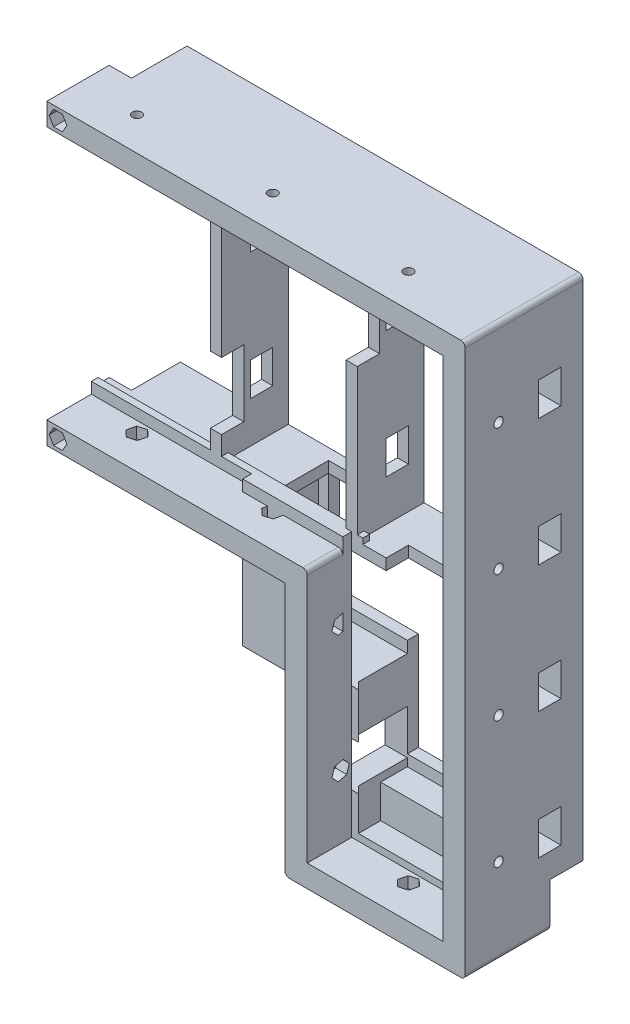
from build123d import *

# Parameters (mm, degrees)
SALIENTE_EXTRUIR1_DEPTH        = 23
CORTAR_EXTRUIR1_DEPTH          = 20
CORTAR_EXTRUIR17_DEPTH         = 231.271578793
SALIENTE_EXTRUIR5_DEPTH        = 30
CORTAR_EXTRUIR18_DEPTH         = 3
SALIENTE_EXTRUIR6_REACH        = 309.885
CROQUIS26_W                    = 5
CROQUIS26_H                    = 30
CROQUIS27_W                    = 30
CROQUIS27_H                    = 5
SALIENTE_EXTRUIR7_DEPTH        = 366
CROQUIS4_W                     = 10
CROQUIS4_H                     = 15
CORTAR_EXTRUIR3_DEPTH          = 407.536591219
CROQUIS6_R                     = 2.1
CORTAR_EXTRUIR5_DEPTH          = 316.678634057
CORTAR_EXTRUIR6_DEPTH          = 5
CORTAR_EXTRUIR7_DEPTH          = 5
CORTAR_EXTRUIR8_DEPTH          = 5
CROQUIS11_R                    = 2.1
CORTAR_EXTRUIR9_DEPTH          = 407.536591219
CORTAR_EXTRUIR10_DEPTH         = 5
CORTAR_EXTRUIR11_DEPTH         = 5
CORTAR_EXTRUIR12_DEPTH         = 5
CORTAR_EXTRUIR13_DEPTH         = 5
CROQUIS28_W                    = 15
CROQUIS28_H                    = 20
CORTAR_EXTRUIR19_DEPTH         = 407.536591219
SALIENTE_EXTRUIR8_DEPTH        = 72
CORTAR_EXTRUIR20_REACH         = 344.173
CROQUIS31_W                    = 10
CROQUIS31_H                    = 30
MATRIZL1_COUNT                 = 3
MATRIZL1_PITCH                 = 122
CORTAR_EXTRUIR28_REACH         = 288.476
CROQUIS40_W                    = 10
CROQUIS40_H                    = 30
MATRIZL2_COUNT                 = 2
MATRIZL2_PITCH                 = 122
CROQUIS32_W                    = 30
CROQUIS32_H                    = 10
CORTAR_EXTRUIR21_DEPTH         = 10
CROQUIS41_W                    = 71
CROQUIS41_H                    = 5
SALIENTE_EXTRUIR9_DEPTH        = 5
CORTAR_EXTRUIR22_REACH         = 332.607
CROQUIS34_W                    = 25
CROQUIS34_H                    = 20
CROQUIS37_R                    = 2.1
CORTAR_EXTRUIR25_DEPTH         = 236.44426092
CROQUIS38_R                    = 3.45
CORTAR_EXTRUIR26_DEPTH         = 10
CORTAR_EXTRUIR27_DEPTH         = 10
CROQUIS42_W                    = 45
CROQUIS42_H                    = 65
SALIENTE_EXTRUIR10_DEPTH       = 4
SALIENTE_EXTRUIR11_DEPTH       = 33
CORTAR_EXTRUIR29_DEPTH         = 235.787137637
CORTAR_EXTRUIR29_DEPTH_BACK    = 30
CROQUIS44_W                    = 45
CROQUIS44_H                    = 52.5
CORTAR_EXTRUIR30_REACH         = 300.624
CROQUIS45_W                    = 10
CROQUIS45_H                    = 15
SALIENTE_EXTRUIR13_DEPTH       = 5
CORTAR_EXTRUIR31_REACH         = 234.704
CROQUIS47_W                    = 28.571161612
CROQUIS47_H                    = 21.740174065
CORTAR_EXTRUIR24_START         = -30
CORTAR_EXTRUIR24_OUTLINE_W     = 56
CORTAR_EXTRUIR24_OUTLINE_H     = 104
CORTAR_EXTRUIR24_DEPTH         = 53
CORTAR_EXTRUIR24_2_OUTLINE_W   = 10
CORTAR_EXTRUIR24_2_OUTLINE_H   = 12.5
CORTAR_EXTRUIR24_2_OUTLINE_R   = 2.1
CORTAR_EXTRUIR24_2_OUTLINE_H_2 = 10
CORTAR_EXTRUIR24_2_DEPTH       = 25
REDONDEO1_R                    = 2
CHAFL_N1_SIZE                  = 5


# Read off the part's stored shape, not the designer's step: Cortar-Extruir24
with BuildPart() as part:
    # Croquis1 → Saliente-Extruir1 (new body)
    with BuildSketch(Plane.XY):
        Polygon((-193, -124), (-193, 124), (193, 124), (193, -124), (112, -124), (112, -10), (-112, -10), (-112, -124), align=None)
    extrude(amount=SALIENTE_EXTRUIR1_DEPTH)

    # Croquis2 → Cortar-Extruir1 (cut)
    with BuildSketch(Plane.XY.offset(23)):
        Polygon((-183, 114), (183, 114), (183, -114), (122, -114), (122, 0), (-122, 0), (-122, -114), (-183, -114), align=None)
    extrude(amount=-CORTAR_EXTRUIR1_DEPTH, mode=Mode.SUBTRACT)

    # Croquis23 → Cortar-Extruir17 (cut, through all)
    with BuildSketch(Plane.XY.offset(3)):
        Polygon((-178, 109), (-178, -109), (-127, -109), (-127, 5), (127, 5), (127, -109), (178, -109), (178, 109), align=None)
    extrude(amount=-CORTAR_EXTRUIR17_DEPTH, mode=Mode.SUBTRACT)

    # Croquis24 → Saliente-Extruir5 (add)
    with BuildSketch(Plane(origin=(0, 0, 0), x_dir=(-1, 0, 0), z_dir=(0, 0, -1))):
        Polygon((-112, -124), (-193, -124), (-193, 124), (193, 124), (193, -124), (112, -124), (112, -10), (-112, -10), align=None)
        Polygon((-122, -114), (-183, -114), (-183, 114), (183, 114), (183, -114), (122, -114), (122, 0), (-122, 0), align=None, mode=Mode.SUBTRACT)
    extrude(amount=SALIENTE_EXTRUIR5_DEPTH)

    # Croquis25 → Cortar-Extruir18 (cut)
    with BuildSketch(Plane(origin=(0, 0, -30), x_dir=(-1, 0, 0), z_dir=(0, 0, -1))):
        Polygon((188, -119), (188, 119), (-188, 119), (-188, -119), (-117, -119), (-117, -5), (117, -5), (117, -119), align=None)
    extrude(amount=-CORTAR_EXTRUIR18_DEPTH, mode=Mode.SUBTRACT)

    # Saliente-Extruir6: up to this face of the body (flat: up to its plane)
    saliente_extruir6_end = Plane(part.part.faces().sort_by_distance((0, 0, -13.5))[0])
    # Croquis26 → Saliente-Extruir6 (add, up to the picked face)
    with BuildSketch(Plane.XZ.offset(-114), mode=Mode.PRIVATE) as saliente_extruir6_sk1:
        with Locations((-122, -12)):
            Rectangle(CROQUIS26_W, CROQUIS26_H)
    saliente_extruir6_tool1 = split(extrude(saliente_extruir6_sk1.sketch, amount=SALIENTE_EXTRUIR6_REACH, mode=Mode.PRIVATE), bisect_by=saliente_extruir6_end, keep=Keep.BOTH, mode=Mode.PRIVATE)
    # Croquis26 → Saliente-Extruir6 (add, up to the picked face)
    with BuildSketch(Plane.XZ.offset(-114), mode=Mode.PRIVATE) as saliente_extruir6_sk2:
        with Locations((122, -12)):
            Rectangle(CROQUIS26_W, CROQUIS26_H)
    saliente_extruir6_tool2 = split(extrude(saliente_extruir6_sk2.sketch, amount=SALIENTE_EXTRUIR6_REACH, mode=Mode.PRIVATE), bisect_by=saliente_extruir6_end, keep=Keep.BOTH, mode=Mode.PRIVATE)
    # Croquis26 → Saliente-Extruir6 (add, up to the picked face)
    with BuildSketch(Plane.XZ.offset(-114), mode=Mode.PRIVATE) as saliente_extruir6_sk3:
        with Locations((0, -12)):
            Rectangle(CROQUIS26_W, CROQUIS26_H)
    saliente_extruir6_tool3 = split(extrude(saliente_extruir6_sk3.sketch, amount=SALIENTE_EXTRUIR6_REACH, mode=Mode.PRIVATE), bisect_by=saliente_extruir6_end, keep=Keep.BOTH, mode=Mode.PRIVATE)
    # Croquis26 → Saliente-Extruir6 (add, up to the picked face)
    with BuildSketch(Plane.XZ.offset(-114), mode=Mode.PRIVATE) as saliente_extruir6_sk4:
        with Locations((-61, -12)):
            Rectangle(CROQUIS26_W, CROQUIS26_H)
    saliente_extruir6_tool4 = split(extrude(saliente_extruir6_sk4.sketch, amount=SALIENTE_EXTRUIR6_REACH, mode=Mode.PRIVATE), bisect_by=saliente_extruir6_end, keep=Keep.BOTH, mode=Mode.PRIVATE)
    # Croquis26 → Saliente-Extruir6 (add, up to the picked face)
    with BuildSketch(Plane.XZ.offset(-114), mode=Mode.PRIVATE) as saliente_extruir6_sk5:
        with Locations((61, -12)):
            Rectangle(CROQUIS26_W, CROQUIS26_H)
    saliente_extruir6_tool5 = split(extrude(saliente_extruir6_sk5.sketch, amount=SALIENTE_EXTRUIR6_REACH, mode=Mode.PRIVATE), bisect_by=saliente_extruir6_end, keep=Keep.BOTH, mode=Mode.PRIVATE)
    add(saliente_extruir6_tool1.solids().sort_by(Axis((-122, 114, -12), (0, -1, 0)))[0])
    add(saliente_extruir6_tool2.solids().sort_by(Axis((122, 114, -12), (0, -1, 0)))[0])
    add(saliente_extruir6_tool3.solids().sort_by(Axis((0, 114, -12), (0, -1, 0)))[0])
    add(saliente_extruir6_tool4.solids().sort_by(Axis((-61, 114, -12), (0, -1, 0)))[0])
    add(saliente_extruir6_tool5.solids().sort_by(Axis((61, 114, -12), (0, -1, 0)))[0])

    # Croquis27 → Saliente-Extruir7 (add)
    with BuildSketch(Plane(origin=(-183, 0, 0), x_dir=(0, 0, -1), z_dir=(1, 0, 0))):
        with Locations((12, 0)):
            Rectangle(CROQUIS27_W, CROQUIS27_H)
    saliente_extruir7 = extrude(amount=SALIENTE_EXTRUIR7_DEPTH)

    # Simetría6: Saliente-Extruir7 across plane
    add(saliente_extruir7.mirror(Plane(origin=(0, 0, 0), x_dir=(0, 0, 1), z_dir=(1, 0, 0))))

    # Croquis4 → Cortar-Extruir3 (cut, through all)
    with BuildSketch(Plane(origin=(193, 0, 0), x_dir=(0, 0, -1), z_dir=(1, 0, 0))):
        with Locations((15, 85.5)):
            Rectangle(CROQUIS4_W, CROQUIS4_H)
        with Locations((15, 28.5)):
            Rectangle(CROQUIS4_W, CROQUIS4_H)
        with Locations((15, -28.5)):
            Rectangle(CROQUIS4_W, CROQUIS4_H)
        with Locations((15, -85.5)):
            Rectangle(CROQUIS4_W, CROQUIS4_H)
    extrude(amount=-CORTAR_EXTRUIR3_DEPTH, mode=Mode.SUBTRACT)

    # Croquis6 → Cortar-Extruir5 (cut, through all)
    with BuildSketch(Plane(origin=(0, 124, 0), x_dir=(1, 0, 0), z_dir=(0, 1, 0))):
        with Locations(Location((30.5, -8, 0), (0, 0, 270))):
            Circle(CROQUIS6_R)
        with Locations(Location((91.5, -8, 0), (0, 0, 270))):
            Circle(CROQUIS6_R)
        with Locations(Location((152.5, -8, 0), (0, 0, 270))):
            Circle(CROQUIS6_R)
    cortar_extruir5 = extrude(amount=-CORTAR_EXTRUIR5_DEPTH, mode=Mode.SUBTRACT)

    # Croquis7 → Cortar-Extruir6 (cut)
    with BuildSketch(Plane.XZ.offset(-114)):
        Polygon((31.42633523, 4.125480282), (34.318600118, 6.864969983), (33.392264888, 10.7394897), (29.57366477, 11.874519718), (26.681399882, 9.135030017), (27.607735112, 5.2605103), align=None)
        Polygon((92.42633523, 4.125480282), (95.318600118, 6.864969983), (94.392264888, 10.7394897), (90.57366477, 11.874519718), (87.681399882, 9.135030017), (88.607735112, 5.2605103), align=None)
        Polygon((153.42633523, 4.125480282), (156.318600118, 6.864969983), (155.392264888, 10.7394897), (151.57366477, 11.874519718), (148.681399882, 9.135030017), (149.607735112, 5.2605103), align=None)
    cortar_extruir6 = extrude(amount=-CORTAR_EXTRUIR6_DEPTH, mode=Mode.SUBTRACT)

    # Croquis9 → Cortar-Extruir7 (cut)
    with BuildSketch(Plane(origin=(0, 0, 0), x_dir=(1, 0, 0), z_dir=(0, 1, 0))):
        Polygon((31.42633523, -4.125480282), (27.607735112, -5.2605103), (26.681399882, -9.135030017), (29.57366477, -11.874519718), (33.392264888, -10.7394897), (34.318600118, -6.864969983), align=None)
        Polygon((92.42633523, -4.125480282), (88.607735112, -5.2605103), (87.681399882, -9.135030017), (90.57366477, -11.874519718), (94.392264888, -10.7394897), (95.318600118, -6.864969983), align=None)
    cortar_extruir7 = extrude(amount=-CORTAR_EXTRUIR7_DEPTH, mode=Mode.SUBTRACT)

    # Croquis10 → Cortar-Extruir8 (cut)
    with BuildSketch(Plane(origin=(0, -114, 0), x_dir=(1, 0, 0), z_dir=(0, 1, 0))):
        Polygon((153.42633523, -4.125480282), (149.607735112, -5.2605103), (148.681399882, -9.135030017), (151.57366477, -11.874519718), (155.392264888, -10.7394897), (156.318600118, -6.864969983), align=None)
    cortar_extruir8 = extrude(amount=-CORTAR_EXTRUIR8_DEPTH, mode=Mode.SUBTRACT)

    # Simetría5: Cortar-Extruir5, Cortar-Extruir6, Cortar-Extruir7, Cortar-Extruir8 across plane
    add(cortar_extruir5.mirror(Plane(origin=(0, 0, 0), x_dir=(0, 0, 1), z_dir=(1, 0, 0))), mode=Mode.SUBTRACT)
    add(cortar_extruir6.mirror(Plane(origin=(0, 0, 0), x_dir=(0, 0, 1), z_dir=(1, 0, 0))), mode=Mode.SUBTRACT)
    add(cortar_extruir7.mirror(Plane(origin=(0, 0, 0), x_dir=(0, 0, 1), z_dir=(1, 0, 0))), mode=Mode.SUBTRACT)
    add(cortar_extruir8.mirror(Plane(origin=(0, 0, 0), x_dir=(0, 0, 1), z_dir=(1, 0, 0))), mode=Mode.SUBTRACT)

    # Croquis11 → Cortar-Extruir9 (cut, through all)
    with BuildSketch(Plane.ZY.offset(193)):
        with Locations((8, 85.5)):
            Circle(CROQUIS11_R)
        with Locations((8, 28.5)):
            Circle(CROQUIS11_R)
        with Locations((8, -28.5)):
            Circle(CROQUIS11_R)
        with Locations((8, -85.5)):
            Circle(CROQUIS11_R)
    extrude(amount=-CORTAR_EXTRUIR9_DEPTH, mode=Mode.SUBTRACT)

    # Croquis12 → Cortar-Extruir10 (cut)
    with BuildSketch(Plane(origin=(-183, 0, 0), x_dir=(0, 0, -1), z_dir=(1, 0, 0))):
        Polygon((-4.125480282, 84.57366477), (-5.2605103, 88.392264888), (-9.135030017, 89.318600118), (-11.874519718, 86.42633523), (-10.7394897, 82.607735112), (-6.864969983, 81.681399882), align=None)
        Polygon((-4.125480282, 27.57366477), (-5.2605103, 31.392264888), (-9.135030017, 32.318600118), (-11.874519718, 29.42633523), (-10.7394897, 25.607735112), (-6.864969983, 24.681399882), align=None)
        Polygon((-4.125480282, -29.42633523), (-5.2605103, -25.607735112), (-9.135030017, -24.681399882), (-11.874519718, -27.57366477), (-10.7394897, -31.392264888), (-6.864969983, -32.318600118), align=None)
        Polygon((-4.125480282, -86.42633523), (-5.2605103, -82.607735112), (-9.135030017, -81.681399882), (-11.874519718, -84.57366477), (-10.7394897, -88.392264888), (-6.864969983, -89.318600118), align=None)
    extrude(amount=-CORTAR_EXTRUIR10_DEPTH, mode=Mode.SUBTRACT)

    # Croquis13 → Cortar-Extruir11 (cut)
    with BuildSketch(Plane.ZY.offset(-183)):
        Polygon((8, 24.516283143), (11.45, 26.508141571), (11.45, 30.491858429), (8, 32.483716857), (4.55, 30.491858429), (4.55, 26.508141571), align=None)
        Polygon((8, 81.516283143), (11.45, 83.508141571), (11.45, 87.491858429), (8, 89.483716857), (4.55, 87.491858429), (4.55, 83.508141571), align=None)
        Polygon((8, -32.483716857), (11.45, -30.491858429), (11.45, -26.508141571), (8, -24.516283143), (4.55, -26.508141571), (4.55, -30.491858429), align=None)
        Polygon((8, -89.483716857), (11.45, -87.491858429), (11.45, -83.508141571), (8, -81.516283143), (4.55, -83.508141571), (4.55, -87.491858429), align=None)
    extrude(amount=-CORTAR_EXTRUIR11_DEPTH, mode=Mode.SUBTRACT)

    # Croquis14 → Cortar-Extruir12 (cut)
    with BuildSketch(Plane(origin=(122, 0, 0), x_dir=(0, 0, -1), z_dir=(1, 0, 0))):
        Polygon((-4.125480282, -84.57366477), (-6.864969983, -81.681399882), (-10.7394897, -82.607735112), (-11.874519718, -86.42633523), (-9.135030017, -89.318600118), (-5.2605103, -88.392264888), align=None)
        Polygon((-4.125480282, -27.57366477), (-6.864969983, -24.681399882), (-10.7394897, -25.607735112), (-11.874519718, -29.42633523), (-9.135030017, -32.318600118), (-5.2605103, -31.392264888), align=None)
    extrude(amount=-CORTAR_EXTRUIR12_DEPTH, mode=Mode.SUBTRACT)

    # Croquis15 → Cortar-Extruir13 (cut)
    with BuildSketch(Plane.ZY.offset(122)):
        Polygon((4.125480282, -84.57366477), (5.2605103, -88.392264888), (9.135030017, -89.318600118), (11.874519718, -86.42633523), (10.7394897, -82.607735112), (6.864969983, -81.681399882), align=None)
        Polygon((4.125480282, -27.57366477), (5.2605103, -31.392264888), (9.135030017, -32.318600118), (11.874519718, -29.42633523), (10.7394897, -25.607735112), (6.864969983, -24.681399882), align=None)
    extrude(amount=-CORTAR_EXTRUIR13_DEPTH, mode=Mode.SUBTRACT)

    # Croquis28 → Cortar-Extruir19 (cut, through all)
    with BuildSketch(Plane.ZY.offset(193)):
        with Locations((-22.5, -114)):
            Rectangle(CROQUIS28_W, CROQUIS28_H)
    extrude(amount=-CORTAR_EXTRUIR19_DEPTH, mode=Mode.SUBTRACT)

    # Croquis30 → Saliente-Extruir8 (add)
    with BuildSketch(Plane.ZY.offset(117)):
        Polygon((-30, -104), (-30, -99), (-10, -99), (-10, -124), (-15, -124), (-15, -104), align=None)
    saliente_extruir8 = extrude(amount=SALIENTE_EXTRUIR8_DEPTH)

    # Simetría7: Saliente-Extruir8 across plane
    add(saliente_extruir8.mirror(Plane(origin=(0, 0, 0), x_dir=(0, 0, 1), z_dir=(1, 0, 0))))

    # Croquis31 → Cortar-Extruir20 (cut, up to next)
    with BuildSketch(Plane.ZY.offset(124.5), mode=Mode.PRIVATE) as cortar_extruir20_sk1:
        with Locations((-2, 85.5)):
            Rectangle(CROQUIS31_W, CROQUIS31_H)
    cortar_extruir20_tool1 = extrude(cortar_extruir20_sk1.sketch, amount=-CORTAR_EXTRUIR20_REACH, mode=Mode.PRIVATE) & part.part
    cortar_extruir20 = cortar_extruir20_tool1.solids().sort_by_distance((-124.5, 85.5, -2))[0]
    add(cortar_extruir20, mode=Mode.SUBTRACT)

    # MatrizL1: Cortar-Extruir20 ×3
    with Locations(*[(i * MATRIZL1_PITCH, 0, 0) for i in range(1, MATRIZL1_COUNT)]):
        add(cortar_extruir20, mode=Mode.SUBTRACT)

    # Croquis40 → Cortar-Extruir28 (cut, up to next)
    with BuildSketch(Plane.ZY.offset(63.5), mode=Mode.PRIVATE) as cortar_extruir28_sk1:
        with Locations((-2, 28.5)):
            Rectangle(CROQUIS40_W, CROQUIS40_H)
    cortar_extruir28_tool1 = extrude(cortar_extruir28_sk1.sketch, amount=-CORTAR_EXTRUIR28_REACH, mode=Mode.PRIVATE) & part.part
    cortar_extruir28 = cortar_extruir28_tool1.solids().sort_by_distance((-63.5, 28.5, -2))[0]
    add(cortar_extruir28, mode=Mode.SUBTRACT)

    # MatrizL2: Cortar-Extruir28 ×2
    with Locations(*[(i * MATRIZL2_PITCH, 0, 0) for i in range(1, MATRIZL2_COUNT)]):
        add(cortar_extruir28, mode=Mode.SUBTRACT)

    # Croquis32 → Cortar-Extruir21 (cut)
    with BuildSketch(Plane.XZ.offset(2.5)):
        with Locations((-152.5, -2)):
            Rectangle(CROQUIS32_W, CROQUIS32_H)
        with Locations((152.5, -2)):
            Rectangle(CROQUIS32_W, CROQUIS32_H)
    extrude(amount=-CORTAR_EXTRUIR21_DEPTH, mode=Mode.SUBTRACT)

    # Croquis41 → Saliente-Extruir9 (add)
    with BuildSketch(Plane(origin=(0, 0, -27), x_dir=(-1, 0, 0), z_dir=(0, 0, -1))):
        with Locations((-152.5, -96.5)):
            Rectangle(CROQUIS41_W, CROQUIS41_H)
    extrude(amount=-SALIENTE_EXTRUIR9_DEPTH)

    # Croquis34 → Cortar-Extruir22 (cut, up to next)
    with BuildSketch(Plane(origin=(-112, 0, 0), x_dir=(0, 0, -1), z_dir=(1, 0, 0)), mode=Mode.PRIVATE) as cortar_extruir22_sk1:
        with Locations((9.5, -85.5)):
            Rectangle(CROQUIS34_W, CROQUIS34_H)
    cortar_extruir22_tool1 = extrude(cortar_extruir22_sk1.sketch, amount=-CORTAR_EXTRUIR22_REACH, mode=Mode.PRIVATE) & part.part
    cortar_extruir22 = cortar_extruir22_tool1.solids().sort_by_distance((-112, -85.5, -9.5))[0]
    add(cortar_extruir22, mode=Mode.SUBTRACT)

    # Simetría8: Cortar-Extruir22 across plane
    add(cortar_extruir22.mirror(Plane(origin=(0, 0, 0), x_dir=(0, 0, 1), z_dir=(1, 0, 0))), mode=Mode.SUBTRACT)

    # Croquis37 → Cortar-Extruir25 (cut, through all)
    with BuildSketch(Plane.XY.offset(23)):
        with Locations((10, -5)):
            Circle(CROQUIS37_R)
        with Locations((10, 119)):
            Circle(CROQUIS37_R)
    extrude(amount=-CORTAR_EXTRUIR25_DEPTH, mode=Mode.SUBTRACT)

    # Croquis38 → Cortar-Extruir26 (cut)
    with BuildSketch(Plane(origin=(0, 0, -30), x_dir=(-1, 0, 0), z_dir=(0, 0, -1))):
        with Locations((-10, -5)):
            Circle(CROQUIS38_R)
        with Locations((-10, 119)):
            Circle(CROQUIS38_R)
    extrude(amount=-CORTAR_EXTRUIR26_DEPTH, mode=Mode.SUBTRACT)

    # Croquis39 → Cortar-Extruir27 (cut)
    with BuildSketch(Plane.XY.offset(23)):
        Polygon((6.016283143, -5), (8.008141571, -8.45), (11.991858429, -8.45), (13.983716857, -5), (11.991858429, -1.55), (8.008141571, -1.55), align=None)
        Polygon((6.016283143, 119), (8.008141571, 115.55), (11.991858429, 115.55), (13.983716857, 119), (11.991858429, 122.45), (8.008141571, 122.45), align=None)
    extrude(amount=-CORTAR_EXTRUIR27_DEPTH, mode=Mode.SUBTRACT)

    # Croquis42 → Saliente-Extruir10 (add)
    with BuildSketch(Plane.XY.offset(3)):
        with Locations((99.5, -27.5)):
            Rectangle(CROQUIS42_W, CROQUIS42_H)
    extrude(amount=SALIENTE_EXTRUIR10_DEPTH)

    # Croquis43 → Saliente-Extruir11 (add)
    with BuildSketch(Plane(origin=(0, 0, 3), x_dir=(-1, 0, 0), z_dir=(0, 0, -1))):
        Polygon((-112, -60), (-112, -55), (-82, -55), (-82, -10), (-77, -10), (-77, -60), align=None)
    extrude(amount=SALIENTE_EXTRUIR11_DEPTH)

    # Croquis44 → Cortar-Extruir29 (cut, two sides: drawn at the far end of the back side and taken through both)
    with BuildSketch(Plane(origin=(0, 0, -27), x_dir=(-1, 0, 0), z_dir=(0, 0, -1)).offset(-CORTAR_EXTRUIR29_DEPTH_BACK)):
        with Locations((-104.5, -28.75)):
            Rectangle(CROQUIS44_W, CROQUIS44_H)
    extrude(amount=CORTAR_EXTRUIR29_DEPTH + CORTAR_EXTRUIR29_DEPTH_BACK, mode=Mode.SUBTRACT)

    # Croquis45 → Cortar-Extruir30 (cut, up to next)
    with BuildSketch(Plane.ZY.offset(-77), mode=Mode.PRIVATE) as cortar_extruir30_sk1:
        with Locations((-15, -28.5)):
            Rectangle(CROQUIS45_W, CROQUIS45_H)
    cortar_extruir30_tool1 = extrude(cortar_extruir30_sk1.sketch, amount=-CORTAR_EXTRUIR30_REACH, mode=Mode.PRIVATE) & part.part
    add(cortar_extruir30_tool1.solids().sort_by_distance((77, -28.5, -15))[0], mode=Mode.SUBTRACT)

    # Croquis46 → Saliente-Extruir13 (add)
    with BuildSketch(Plane(origin=(0, 0, -27), x_dir=(-1, 0, 0), z_dir=(0, 0, -1))):
        Polygon((-122, -55), (-122, -49.816161807), (-86.602121083, -49.816161807), (-86.602121083, -2.5), (-82, -2.5), (-82, -55), align=None)
    extrude(amount=-SALIENTE_EXTRUIR13_DEPTH)

    # Croquis47 → Cortar-Extruir31 (cut, up to next)
    with BuildSketch(Plane.XZ.offset(2.5), mode=Mode.PRIVATE) as cortar_extruir31_sk1:
        with Locations((100.887701889, -11.129912967)):
            Rectangle(CROQUIS47_W, CROQUIS47_H)
    cortar_extruir31_tool1 = extrude(cortar_extruir31_sk1.sketch, amount=-CORTAR_EXTRUIR31_REACH, mode=Mode.PRIVATE) & part.part
    add(cortar_extruir31_tool1.solids().sort_by_distance((100.887702, -2.5, -11.129913))[0], mode=Mode.SUBTRACT)

    # Cortar-Extruir24 outline → Cortar-Extruir24 (cut)
    with BuildSketch(Plane.XY.offset(CORTAR_EXTRUIR24_START)):
        Polygon((-112, -10), (5, -10), (5, 5), (2.5, 5), (2.5, 109), (5, 109), (5, 124), (-193, 124), (-193, -124), (-112, -124), align=None)
        Polygon((-127, -2.5), (-127, -75.5), (-122, -75.5), (-122, -95.5), (-127, -95.5), (-127, -99), (-178, -99), (-178, -2.5), align=None, mode=Mode.SUBTRACT)
        Polygon((-127, 2.5), (-178, 2.5), (-178, 109), (-124.5, 109), (-124.5, 5), (-127, 5), align=None, mode=Mode.SUBTRACT)
        with Locations((-91.5, 57)):
            Rectangle(CORTAR_EXTRUIR24_OUTLINE_W, CORTAR_EXTRUIR24_OUTLINE_H, mode=Mode.SUBTRACT)
        with Locations((-30.5, 57)):
            Rectangle(CORTAR_EXTRUIR24_OUTLINE_W, CORTAR_EXTRUIR24_OUTLINE_H, mode=Mode.SUBTRACT)
    extrude(amount=CORTAR_EXTRUIR24_DEPTH, mode=Mode.SUBTRACT)

    # Cortar-Extruir24 2 outline → Cortar-Extruir24 2 (cut)
    # profile 1 of 2: a face of its own
    with BuildSketch(Plane.XY.offset(CORTAR_EXTRUIR24_START)):
        with Locations((10, -3.75)):
            Rectangle(CORTAR_EXTRUIR24_2_OUTLINE_W, CORTAR_EXTRUIR24_2_OUTLINE_H)
        with Locations((10, -5)):
            Circle(CORTAR_EXTRUIR24_2_OUTLINE_R, mode=Mode.SUBTRACT)
    # profile 2 of 2: a face of its own
    with BuildSketch(Plane.XY.offset(CORTAR_EXTRUIR24_START)):
        with Locations((10, 119)):
            Rectangle(CORTAR_EXTRUIR24_2_OUTLINE_W, CORTAR_EXTRUIR24_2_OUTLINE_H_2)
        with Locations((10, 119)):
            Circle(CORTAR_EXTRUIR24_2_OUTLINE_R, mode=Mode.SUBTRACT)
    extrude(amount=CORTAR_EXTRUIR24_2_DEPTH, mode=Mode.SUBTRACT)

    # Redondeo1
    redondeo1_edges = [part.edges().sort_by_distance(p)[0] for p in [
        (193, -124, 4),
        (112, -124, 4),
        (193, 124, -3.5),
        (122, 0, 15),
    ]]
    fillet(redondeo1_edges, radius=REDONDEO1_R)

    # Chaflán1
    # the kernel refuses this chamfer: 5 mm, written as the material it takes off along each edge
    with BuildSketch(Plane(origin=(111.64158506, 109, 0), x_dir=(0, 0.9996219169112968, -0.027495876610586334), z_dir=(1, 0, 0))) as chafl_n1_piece_1_section:
        Polygon((CHAFL_N1_SIZE * 0.999621916911, CHAFL_N1_SIZE * 0.0274958766106), (-CHAFL_N1_SIZE * 0.0274958766106, CHAFL_N1_SIZE * 0.999621916911), (0, 0), align=None)
    chafl_n1_piece_1 = extrude(amount=66.35841494, mode=Mode.PRIVATE)
    chafl_n1_piece_1 = split(chafl_n1_piece_1, bisect_by=Plane(origin=(119.5, 110.643171669, 1.652020772), z_dir=(-1, 0, 0)), keep=Keep.TOP, mode=Mode.PRIVATE)
    chafl_n1_piece_1 = split(chafl_n1_piece_1, bisect_by=Plane(origin=(115.57079253, 114, 1.652020772), z_dir=(0, -1, 0)), keep=Keep.TOP, mode=Mode.PRIVATE)
    add(chafl_n1_piece_1, mode=Mode.SUBTRACT)
    with BuildSketch(Plane(origin=(124.5, 109, 0), x_dir=(0, 0.9996219169112968, -0.027495876610586334), z_dir=(1, 0, 0))) as chafl_n1_piece_2_section:
        Polygon((CHAFL_N1_SIZE * 0.999621916911, CHAFL_N1_SIZE * 0.0274958766106), (-CHAFL_N1_SIZE * 0.0274958766106, CHAFL_N1_SIZE * 0.999621916911), (0, 0), align=None)
    chafl_n1_piece_2 = extrude(amount=53.5, mode=Mode.PRIVATE)
    chafl_n1_piece_2 = split(chafl_n1_piece_2, bisect_by=Plane(origin=(151.25, 114, 1.652020772), z_dir=(0, -1, 0)), keep=Keep.TOP, mode=Mode.PRIVATE)
    add(chafl_n1_piece_2, mode=Mode.SUBTRACT)
    with BuildSketch(Plane(origin=(178, 109, 0), x_dir=(-0.02749587661059322, 0, 0.9996219169112965), z_dir=(0, -1, 0))) as chafl_n1_piece_3_section:
        Polygon((CHAFL_N1_SIZE * 0.999621916911, -CHAFL_N1_SIZE * 0.0274958766106), (-CHAFL_N1_SIZE * 0.0274958766106, -CHAFL_N1_SIZE * 0.999621916911), (0, 0), align=None)
    chafl_n1_piece_3 = extrude(amount=106.5, mode=Mode.PRIVATE)
    chafl_n1_piece_3 = split(chafl_n1_piece_3, bisect_by=Plane(origin=(183, 55.75, 1.652020772), z_dir=(-1, 0, 0)), keep=Keep.TOP, mode=Mode.PRIVATE)
    add(chafl_n1_piece_3, mode=Mode.SUBTRACT)
    with BuildSketch(Plane(origin=(178, 109, 0), x_dir=(-0.02749587661059322, 0, 0.9996219169112965), z_dir=(0, -1, 0))) as chafl_n1_piece_4_section:
        Polygon((CHAFL_N1_SIZE * 0.999621916911, -CHAFL_N1_SIZE * 0.0274958766106), (-CHAFL_N1_SIZE * 0.0274958766106, -CHAFL_N1_SIZE * 0.999621916911), (0, 0), align=None)
    chafl_n1_piece_4 = extrude(amount=119.35841494, mode=Mode.PRIVATE)
    chafl_n1_piece_4 = split(chafl_n1_piece_4, bisect_by=Plane(origin=(179.643171669, -2.5, 1.652020772), z_dir=(0, -1, 0)), keep=Keep.TOP, mode=Mode.PRIVATE)
    chafl_n1_piece_4 = split(chafl_n1_piece_4, bisect_by=Plane(origin=(183, -6.42920747, 1.652020772), z_dir=(-1, 0, 0)), keep=Keep.TOP, mode=Mode.PRIVATE)
    add(chafl_n1_piece_4, mode=Mode.SUBTRACT)
    with BuildSketch(Plane(origin=(-7.85841494, 109, 0), x_dir=(0, -0.0274958766105877, 0.9996219169112968), z_dir=(1, 0, 0))) as chafl_n1_piece_5_section:
        Polygon((CHAFL_N1_SIZE * 0.999621916911, -CHAFL_N1_SIZE * 0.0274958766106), (-CHAFL_N1_SIZE * 0.0274958766106, -CHAFL_N1_SIZE * 0.999621916911), (0, 0), align=None)
    chafl_n1_piece_5 = extrude(amount=66.35841494, mode=Mode.PRIVATE)
    chafl_n1_piece_5 = split(chafl_n1_piece_5, bisect_by=Plane(origin=(25.32079253, 114, 1.652020772), z_dir=(0, -1, 0)), keep=Keep.TOP, mode=Mode.PRIVATE)
    add(chafl_n1_piece_5, mode=Mode.SUBTRACT)
    with BuildSketch(Plane(origin=(-7.85841494, 109, 0), x_dir=(0, -0.0274958766105877, 0.9996219169112968), z_dir=(1, 0, 0))) as chafl_n1_piece_6_section:
        Polygon((CHAFL_N1_SIZE * 0.999621916911, -CHAFL_N1_SIZE * 0.0274958766106), (-CHAFL_N1_SIZE * 0.0274958766106, -CHAFL_N1_SIZE * 0.999621916911), (0, 0), align=None)
    chafl_n1_piece_6 = extrude(amount=79.21682988, mode=Mode.PRIVATE)
    chafl_n1_piece_6 = split(chafl_n1_piece_6, bisect_by=Plane(origin=(67.42920747, 114, 1.652020772), z_dir=(0, -1, 0)), keep=Keep.TOP, mode=Mode.PRIVATE)
    chafl_n1_piece_6 = split(chafl_n1_piece_6, bisect_by=Plane(origin=(63.5, 110.643171669, 1.652020772), z_dir=(1, 0, 0)), keep=Keep.TOP, mode=Mode.PRIVATE)
    add(chafl_n1_piece_6, mode=Mode.SUBTRACT)
    with BuildSketch(Plane(origin=(50.64158506, 109, 0), x_dir=(0, -0.0274958766105877, 0.9996219169112968), z_dir=(1, 0, 0))) as chafl_n1_piece_7_section:
        Polygon((CHAFL_N1_SIZE * 0.999621916911, -CHAFL_N1_SIZE * 0.0274958766106), (-CHAFL_N1_SIZE * 0.0274958766106, -CHAFL_N1_SIZE * 0.999621916911), (0, 0), align=None)
    chafl_n1_piece_7 = extrude(amount=68.85841494, mode=Mode.PRIVATE)
    chafl_n1_piece_7 = split(chafl_n1_piece_7, bisect_by=Plane(origin=(58.5, 110.643171669, 1.652020772), z_dir=(-1, 0, 0)), keep=Keep.TOP, mode=Mode.PRIVATE)
    chafl_n1_piece_7 = split(chafl_n1_piece_7, bisect_by=Plane(origin=(54.57079253, 114, 1.652020772), z_dir=(0, -1, 0)), keep=Keep.TOP, mode=Mode.PRIVATE)
    add(chafl_n1_piece_7, mode=Mode.SUBTRACT)
    with BuildSketch(Plane(origin=(63.5, 109, 0), x_dir=(0, -0.0274958766105877, 0.9996219169112968), z_dir=(1, 0, 0))) as chafl_n1_piece_8_section:
        Polygon((CHAFL_N1_SIZE * 0.999621916911, -CHAFL_N1_SIZE * 0.0274958766106), (-CHAFL_N1_SIZE * 0.0274958766106, -CHAFL_N1_SIZE * 0.999621916911), (0, 0), align=None)
    chafl_n1_piece_8 = extrude(amount=56, mode=Mode.PRIVATE)
    chafl_n1_piece_8 = split(chafl_n1_piece_8, bisect_by=Plane(origin=(91.5, 114, 1.652020772), z_dir=(0, -1, 0)), keep=Keep.TOP, mode=Mode.PRIVATE)
    add(chafl_n1_piece_8, mode=Mode.SUBTRACT)
    with BuildSketch(Plane(origin=(63.5, 109, 0), x_dir=(0, -0.0274958766105877, 0.9996219169112968), z_dir=(1, 0, 0))) as chafl_n1_piece_9_section:
        Polygon((CHAFL_N1_SIZE * 0.999621916911, -CHAFL_N1_SIZE * 0.0274958766106), (-CHAFL_N1_SIZE * 0.0274958766106, -CHAFL_N1_SIZE * 0.999621916911), (0, 0), align=None)
    chafl_n1_piece_9 = extrude(amount=68.85841494, mode=Mode.PRIVATE)
    chafl_n1_piece_9 = split(chafl_n1_piece_9, bisect_by=Plane(origin=(128.42920747, 114, 1.652020772), z_dir=(0, -1, 0)), keep=Keep.TOP, mode=Mode.PRIVATE)
    chafl_n1_piece_9 = split(chafl_n1_piece_9, bisect_by=Plane(origin=(124.5, 110.643171669, 1.652020772), z_dir=(1, 0, 0)), keep=Keep.TOP, mode=Mode.PRIVATE)
    add(chafl_n1_piece_9, mode=Mode.SUBTRACT)
    with BuildSketch(Plane(origin=(127, -88.35841494, 0), x_dir=(-0.9996219169112968, 0, -0.027495876610586334), z_dir=(0, 1, 0))) as chafl_n1_piece_10_section:
        Polygon((CHAFL_N1_SIZE * 0.999621916911, CHAFL_N1_SIZE * 0.0274958766106), (-CHAFL_N1_SIZE * 0.0274958766106, CHAFL_N1_SIZE * 0.999621916911), (0, 0), align=None)
    chafl_n1_piece_10 = extrude(amount=46.21682988, mode=Mode.PRIVATE)
    chafl_n1_piece_10 = split(chafl_n1_piece_10, bisect_by=Plane(origin=(122, -65.25, 1.652020772), z_dir=(1, 0, 0)), keep=Keep.TOP, mode=Mode.PRIVATE)
    add(chafl_n1_piece_10, mode=Mode.SUBTRACT)
    with BuildSketch(Plane(origin=(127, -109, 0), x_dir=(0.0274958766105877, 0, 0.9996219169112968), z_dir=(0, 1, 0))) as chafl_n1_piece_11_section:
        Polygon((CHAFL_N1_SIZE * 0.999621916911, -CHAFL_N1_SIZE * 0.0274958766106), (-CHAFL_N1_SIZE * 0.0274958766106, -CHAFL_N1_SIZE * 0.999621916911), (0, 0), align=None)
    chafl_n1_piece_11 = extrude(amount=26.35841494, mode=Mode.PRIVATE)
    chafl_n1_piece_11 = split(chafl_n1_piece_11, bisect_by=Plane(origin=(122, -95.82079253, 1.652020772), z_dir=(1, 0, 0)), keep=Keep.TOP, mode=Mode.PRIVATE)
    add(chafl_n1_piece_11, mode=Mode.SUBTRACT)
    with BuildSketch(Plane(origin=(178, -109, 0), x_dir=(0, 0.0274958766105877, 0.9996219169112968), z_dir=(-1, 0, 0))) as chafl_n1_piece_12_section:
        Polygon((CHAFL_N1_SIZE * 0.999621916911, -CHAFL_N1_SIZE * 0.0274958766106), (-CHAFL_N1_SIZE * 0.0274958766106, -CHAFL_N1_SIZE * 0.999621916911), (0, 0), align=None)
    chafl_n1_piece_12 = extrude(amount=51, mode=Mode.PRIVATE)
    chafl_n1_piece_12 = split(chafl_n1_piece_12, bisect_by=Plane(origin=(152.5, -114, 1.652020772), z_dir=(0, 1, 0)), keep=Keep.TOP, mode=Mode.PRIVATE)
    add(chafl_n1_piece_12, mode=Mode.SUBTRACT)
    with BuildSketch(Plane(origin=(178, 10.35841494, 0), x_dir=(-0.0274958766105877, 0, 0.9996219169112968), z_dir=(0, -1, 0))) as chafl_n1_piece_13_section:
        Polygon((CHAFL_N1_SIZE * 0.999621916911, -CHAFL_N1_SIZE * 0.0274958766106), (-CHAFL_N1_SIZE * 0.0274958766106, -CHAFL_N1_SIZE * 0.999621916911), (0, 0), align=None)
    chafl_n1_piece_13 = extrude(amount=119.35841494, mode=Mode.PRIVATE)
    chafl_n1_piece_13 = split(chafl_n1_piece_13, bisect_by=Plane(origin=(183, 6.42920747, 1.652020772), z_dir=(-1, 0, 0)), keep=Keep.TOP, mode=Mode.PRIVATE)
    chafl_n1_piece_13 = split(chafl_n1_piece_13, bisect_by=Plane(origin=(179.643171669, 2.5, 1.652020772), z_dir=(0, 1, 0)), keep=Keep.TOP, mode=Mode.PRIVATE)
    add(chafl_n1_piece_13, mode=Mode.SUBTRACT)
    with BuildSketch(Plane(origin=(178, -2.5, 0), x_dir=(-0.02749587661059322, 0, 0.9996219169112965), z_dir=(0, -1, 0))) as chafl_n1_piece_14_section:
        Polygon((CHAFL_N1_SIZE * 0.999621916911, -CHAFL_N1_SIZE * 0.0274958766106), (-CHAFL_N1_SIZE * 0.0274958766106, -CHAFL_N1_SIZE * 0.999621916911), (0, 0), align=None)
    chafl_n1_piece_14 = extrude(amount=106.5, mode=Mode.PRIVATE)
    chafl_n1_piece_14 = split(chafl_n1_piece_14, bisect_by=Plane(origin=(183, -55.75, 1.652020772), z_dir=(-1, 0, 0)), keep=Keep.TOP, mode=Mode.PRIVATE)
    add(chafl_n1_piece_14, mode=Mode.SUBTRACT)
    with BuildSketch(Plane(origin=(178, 121.85841494, 0), x_dir=(-0.0274958766105877, 0, 0.9996219169112968), z_dir=(0, -1, 0))) as chafl_n1_piece_15a_section:
        Polygon((CHAFL_N1_SIZE * 0.999621916911, -CHAFL_N1_SIZE * 0.0274958766106), (-CHAFL_N1_SIZE * 0.0274958766106, -CHAFL_N1_SIZE * 0.999621916911), (0, 0), align=None)
    chafl_n1_piece_15a = extrude(amount=119.35841494, mode=Mode.PRIVATE)
    chafl_n1_piece_15a = split(chafl_n1_piece_15a, bisect_by=Plane(origin=(183, 111.5, 1.652020772), z_dir=(-1, 0, 0)), keep=Keep.TOP, mode=Mode.PRIVATE)
    chafl_n1_piece_15a = split(chafl_n1_piece_15a, bisect_by=Plane(origin=(179.643171669, 109, 1.652020772), z_dir=(0, 1, 0)), keep=Keep.TOP, mode=Mode.PRIVATE)
    chafl_n1_piece_15a = split(chafl_n1_piece_15a, bisect_by=Plane(origin=(179.643171669, 114, 1.652020772), z_dir=(0, -1, 0)), keep=Keep.TOP, mode=Mode.PRIVATE)
    with BuildSketch(Plane(origin=(124.5, 109, 0), x_dir=(0, 0.9996219169112968, -0.027495876610586334), z_dir=(1, 0, 0))) as chafl_n1_piece_15b_section:
        Polygon((CHAFL_N1_SIZE * 0.999621916911, CHAFL_N1_SIZE * 0.0274958766106), (-CHAFL_N1_SIZE * 0.0274958766106, CHAFL_N1_SIZE * 0.999621916911), (0, 0), align=None)
    chafl_n1_piece_15b = extrude(amount=66.35841494, mode=Mode.PRIVATE)
    chafl_n1_piece_15b = split(chafl_n1_piece_15b, bisect_by=Plane(origin=(178, 110.643171669, 1.652020772), z_dir=(1, 0, 0)), keep=Keep.TOP, mode=Mode.PRIVATE)
    chafl_n1_piece_15b = split(chafl_n1_piece_15b, bisect_by=Plane(origin=(183, 110.643171669, 1.652020772), z_dir=(-1, 0, 0)), keep=Keep.TOP, mode=Mode.PRIVATE)
    chafl_n1_piece_15b = split(chafl_n1_piece_15b, bisect_by=Plane(origin=(180.5, 114, 1.652020772), z_dir=(0, -1, 0)), keep=Keep.TOP, mode=Mode.PRIVATE)
    chafl_n1_piece_15 = chafl_n1_piece_15a & chafl_n1_piece_15b
    add(chafl_n1_piece_15, mode=Mode.SUBTRACT)
    with BuildSketch(Plane(origin=(127, -121.85841494, 0), x_dir=(0.0274958766105877, 0, 0.9996219169112968), z_dir=(0, 1, 0))) as chafl_n1_piece_16a_section:
        Polygon((CHAFL_N1_SIZE * 0.999621916911, -CHAFL_N1_SIZE * 0.0274958766106), (-CHAFL_N1_SIZE * 0.0274958766106, -CHAFL_N1_SIZE * 0.999621916911), (0, 0), align=None)
    chafl_n1_piece_16a = extrude(amount=39.21682988, mode=Mode.PRIVATE)
    chafl_n1_piece_16a = split(chafl_n1_piece_16a, bisect_by=Plane(origin=(125.356828331, -109, 1.652020772), z_dir=(0, -1, 0)), keep=Keep.TOP, mode=Mode.PRIVATE)
    chafl_n1_piece_16a = split(chafl_n1_piece_16a, bisect_by=Plane(origin=(122, -111.5, 1.652020772), z_dir=(1, 0, 0)), keep=Keep.TOP, mode=Mode.PRIVATE)
    chafl_n1_piece_16a = split(chafl_n1_piece_16a, bisect_by=Plane(origin=(125.356828331, -114, 1.652020772), z_dir=(0, 1, 0)), keep=Keep.TOP, mode=Mode.PRIVATE)
    with BuildSketch(Plane(origin=(178, -109, 0), x_dir=(0, 0.0274958766105877, 0.9996219169112968), z_dir=(-1, 0, 0))) as chafl_n1_piece_16b_section:
        Polygon((CHAFL_N1_SIZE * 0.999621916911, -CHAFL_N1_SIZE * 0.0274958766106), (-CHAFL_N1_SIZE * 0.0274958766106, -CHAFL_N1_SIZE * 0.999621916911), (0, 0), align=None)
    chafl_n1_piece_16b = extrude(amount=63.85841494, mode=Mode.PRIVATE)
    chafl_n1_piece_16b = split(chafl_n1_piece_16b, bisect_by=Plane(origin=(127, -110.643171669, 1.652020772), z_dir=(-1, 0, 0)), keep=Keep.TOP, mode=Mode.PRIVATE)
    chafl_n1_piece_16b = split(chafl_n1_piece_16b, bisect_by=Plane(origin=(122, -110.643171669, 1.652020772), z_dir=(1, 0, 0)), keep=Keep.TOP, mode=Mode.PRIVATE)
    chafl_n1_piece_16b = split(chafl_n1_piece_16b, bisect_by=Plane(origin=(124.5, -114, 1.652020772), z_dir=(0, 1, 0)), keep=Keep.TOP, mode=Mode.PRIVATE)
    chafl_n1_piece_16 = chafl_n1_piece_16a & chafl_n1_piece_16b
    add(chafl_n1_piece_16, mode=Mode.SUBTRACT)
    with BuildSketch(Plane(origin=(190.85841494, -109, 0), x_dir=(0, 0.0274958766105877, 0.9996219169112968), z_dir=(-1, 0, 0))) as chafl_n1_piece_17a_section:
        Polygon((CHAFL_N1_SIZE * 0.999621916911, -CHAFL_N1_SIZE * 0.0274958766106), (-CHAFL_N1_SIZE * 0.0274958766106, -CHAFL_N1_SIZE * 0.999621916911), (0, 0), align=None)
    chafl_n1_piece_17a = extrude(amount=63.85841494, mode=Mode.PRIVATE)
    chafl_n1_piece_17a = split(chafl_n1_piece_17a, bisect_by=Plane(origin=(178, -110.643171669, 1.652020772), z_dir=(1, 0, 0)), keep=Keep.TOP, mode=Mode.PRIVATE)
    chafl_n1_piece_17a = split(chafl_n1_piece_17a, bisect_by=Plane(origin=(180.5, -114, 1.652020772), z_dir=(0, 1, 0)), keep=Keep.TOP, mode=Mode.PRIVATE)
    chafl_n1_piece_17a = split(chafl_n1_piece_17a, bisect_by=Plane(origin=(183, -110.643171669, 1.652020772), z_dir=(-1, 0, 0)), keep=Keep.TOP, mode=Mode.PRIVATE)
    with BuildSketch(Plane(origin=(178, -2.5, 0), x_dir=(-0.02749587661059322, 0, 0.9996219169112965), z_dir=(0, -1, 0))) as chafl_n1_piece_17b_section:
        Polygon((CHAFL_N1_SIZE * 0.999621916911, -CHAFL_N1_SIZE * 0.0274958766106), (-CHAFL_N1_SIZE * 0.0274958766106, -CHAFL_N1_SIZE * 0.999621916911), (0, 0), align=None)
    chafl_n1_piece_17b = extrude(amount=119.35841494, mode=Mode.PRIVATE)
    chafl_n1_piece_17b = split(chafl_n1_piece_17b, bisect_by=Plane(origin=(179.643171669, -109, 1.652020772), z_dir=(0, -1, 0)), keep=Keep.TOP, mode=Mode.PRIVATE)
    chafl_n1_piece_17b = split(chafl_n1_piece_17b, bisect_by=Plane(origin=(179.643171669, -114, 1.652020772), z_dir=(0, 1, 0)), keep=Keep.TOP, mode=Mode.PRIVATE)
    chafl_n1_piece_17b = split(chafl_n1_piece_17b, bisect_by=Plane(origin=(183, -111.5, 1.652020772), z_dir=(-1, 0, 0)), keep=Keep.TOP, mode=Mode.PRIVATE)
    chafl_n1_piece_17 = chafl_n1_piece_17a & chafl_n1_piece_17b
    add(chafl_n1_piece_17, mode=Mode.SUBTRACT)


solid = part.part
